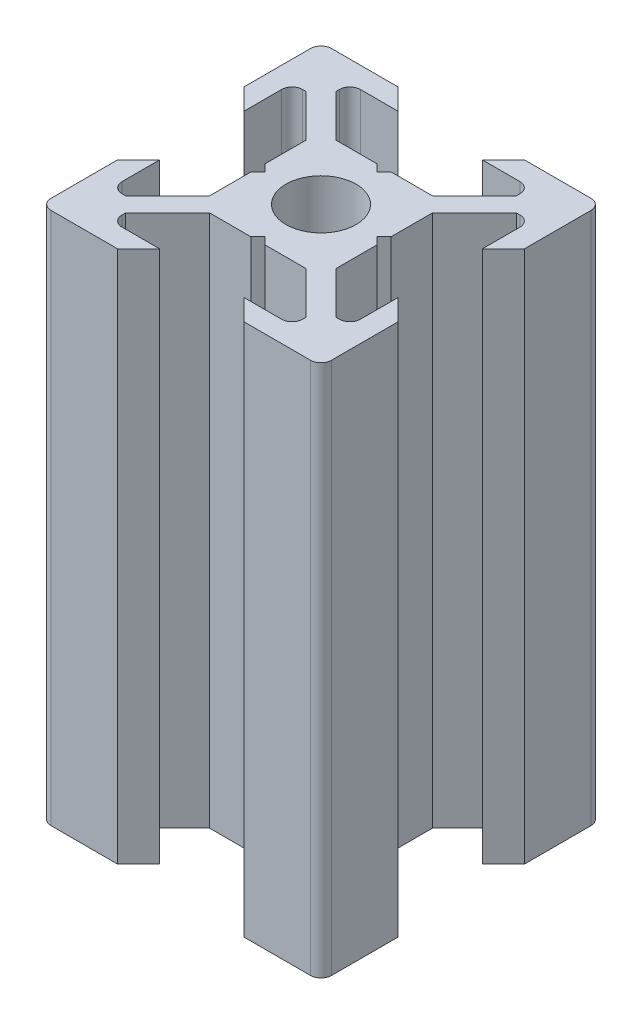
from build123d import *

# Parameters (mm, degrees)
ESQUISSE1_R      = 2.5
EXTRUSION1_DEPTH = 38
CONG_1_R         = 0.75


with BuildPart() as part:
    # Esquisse1 → Extrusion1 (new body)
    with BuildSketch(Plane(origin=(0, 0, 0), x_dir=(1, 0, 0), z_dir=(0, 1, 0))):
        Polygon((0, 4), (-0.5, 4.5), (-3.439339828, 4.5), (-6.439339828, 7.5), (-6.439339828, 8.5), (-3, 8.5), (-4.5, 10), (-10, 10), (-10, 4.5), (-8.5, 3), (-8.5, 6.439339828), (-7.5, 6.439339828), (-4.5, 3.439339828), (-4.5, 0.5), (-4, 0), (-4.5, -0.5), (-4.5, -3.439339828), (-7.5, -6.439339828), (-8.5, -6.439339828), (-8.5, -3), (-10, -4.5), (-10, -10), (-4.5, -10), (-3, -8.5), (-6.439339828, -8.5), (-6.439339828, -7.5), (-3.439339828, -4.5), (-0.5, -4.5), (0, -4), (0.5, -4.5), (3.439339828, -4.5), (6.439339828, -7.5), (6.439339828, -8.5), (3, -8.5), (4.5, -10), (10, -10), (10, -4.5), (8.5, -3), (8.5, -6.439339828), (7.5, -6.439339828), (4.5, -3.439339828), (4.5, -0.5), (4, 0), (4.5, 0.5), (4.5, 3.439339828), (7.5, 6.439339828), (8.5, 6.439339828), (8.5, 3), (10, 4.5), (10, 10), (4.5, 10), (3, 8.5), (6.439339828, 8.5), (6.439339828, 7.5), (3.439339828, 4.5), (0.5, 4.5), align=None)
        Circle(ESQUISSE1_R, mode=Mode.SUBTRACT)
    extrude(amount=EXTRUSION1_DEPTH)

    # Congé1
    cong_1_edges = [part.edges().sort_by_distance(p)[0] for p in [
        (-8.5, 19, -6.439339828),
        (-6.439339828, 19, -8.5),
        (8.5, 19, -6.439339828),
        (6.439339828, 19, -8.5),
        (-8.5, 19, 6.439339828),
        (-6.439339828, 19, 8.5),
        (8.5, 19, 6.439339828),
        (6.439339828, 19, 8.5),
        (10, 19, -10),
        (-10, 19, -10),
        (-10, 19, 10),
        (10, 19, 10),
    ]]
    fillet(cong_1_edges, radius=CONG_1_R)


solid = part.part
